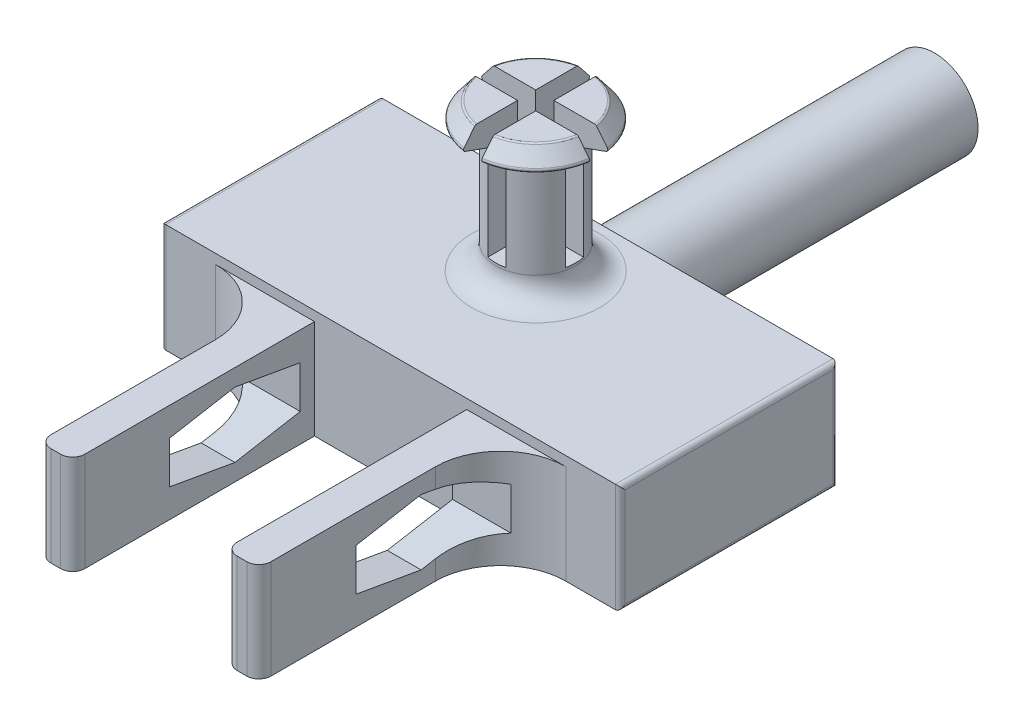
from build123d import *

# Parameters (mm, degrees)
DODANIE_WYCI_GNI_CIE1_DEPTH     = 4.5
DODANIE_WYCI_GNI_CIE2_DEPTH     = 4.1
SZKIC2_R                        = 1.8
DODANIE_WYCI_GNI_CIE3_DEPTH     = 13.5
WYTNIJ_WYCI_GNI_CIE2_DEPTH      = 23.456012558
WYTNIJ_WYCI_GNI_CIE2_DEPTH_BACK = 23.456012558
ZAOKR_GLENIE1_R                 = 0.5
ZAOKR_GLENIE2_R                 = 0.2
SZKIC4_R                        = 1.65
DODANIE_WYCI_GNI_CIE4_DEPTH     = 5.1
SZKIC5_R                        = 1.65
DODANIE_WYCI_GNI_CIE5_DEPTH     = 1
ZAOKR_GLENIE4_R                 = 1
ZAOKR_GLENIE5_R                 = 0.1
WYTNIJ_WYCI_GNI_CIE3_DEPTH      = 5


with BuildPart() as part:
    # Szkic1 → Dodanie-wyciągnięcie1 (new body)
    with BuildSketch(Plane(origin=(0, 0, 0), x_dir=(1, 0, 0), z_dir=(0, 1, 0))):
        Polygon((3.15, -4.5), (4.55, -4.5), (7.25, -4.5), (9.5, -4.5), (9.5, 4.5), (2.579268293, 4.5), (-2.579268293, 4.5), (-9.5, 4.5), (-9.5, -4.5), (-7.25, -4.5), (-4.55, -4.5), (-3.15, -4.5), align=None)
    extrude(amount=DODANIE_WYCI_GNI_CIE1_DEPTH)

    # Szkic1<7> → Dodanie-wyciągnięcie2 (add)
    with BuildSketch(Plane(origin=(0, 0, 0), x_dir=(1, 0, 0), z_dir=(0, 1, 0))):
        with BuildLine():
            Line((4.55, -14.5), (4.55, -7.2))
            ThreePointArc((4.55, -7.2), (5.340811691, -5.290811691), (7.25, -4.5))
            Line((7.25, -4.5), (3.15, -4.5))
            Line((3.15, -4.5), (3.15, -14.5))
            Line((3.15, -14.5), (4.55, -14.5))
        make_face()
        with BuildLine():
            Line((-3.15, -14.5), (-3.15, -4.5))
            Line((-3.15, -4.5), (-7.25, -4.5))
            ThreePointArc((-7.25, -4.5), (-5.340811691, -5.290811691), (-4.55, -7.2))
            Line((-4.55, -7.2), (-4.55, -14.5))
            Line((-4.55, -14.5), (-3.15, -14.5))
        make_face()
    extrude(amount=DODANIE_WYCI_GNI_CIE2_DEPTH)

    # Szkic2 → Dodanie-wyciągnięcie3 (add)
    with BuildSketch(Plane(origin=(0, 0, -4.5), x_dir=(-1, 0, 0), z_dir=(0, 0, -1))):
        with Locations((0, 2.25)):
            Circle(SZKIC2_R)
    extrude(amount=DODANIE_WYCI_GNI_CIE3_DEPTH)

    # Szkic3 → Wytnij-wyciągnięcie2 (cut, two sides: drawn at the far end of the back side and taken through both)
    with BuildSketch(Plane(origin=(-3.15, 0, 0), x_dir=(0, 0, -1), z_dir=(1, 0, 0)).offset(-WYTNIJ_WYCI_GNI_CIE2_DEPTH_BACK)):
        Polygon((-7.790001582, 3.4), (-10.490001582, 2.923917152), (-10.490001582, 1.176082848), (-7.790001582, 0.7), (-5.090001582, 1.176082848), (-5.090001582, 2.923917152), align=None)
    extrude(amount=WYTNIJ_WYCI_GNI_CIE2_DEPTH + WYTNIJ_WYCI_GNI_CIE2_DEPTH_BACK, mode=Mode.SUBTRACT)

    # Zaokrąglenie1
    zaokr_glenie1_edges = [part.edges().sort_by_distance(p)[0] for p in [
        (3.15, 2.05, 14.5),
        (4.55, 2.05, 14.5),
        (-4.55, 2.05, 14.5),
        (-3.15, 2.05, 14.5),
    ]]
    fillet(zaokr_glenie1_edges, radius=ZAOKR_GLENIE1_R)

    # Zaokrąglenie2
    zaokr_glenie2_edges = [part.edges().sort_by_distance(p)[0] for p in [
        (-9.5, 2.25, -4.5),
        (-9.5, 4.5, 0),
        (9.5, 0, 0),
        (-9.5, 2.25, 4.5),
        (9.5, 2.25, 4.5),
        (9.5, 2.25, -4.5),
        (9.5, 4.5, 0),
        (-9.5, 0, 0),
    ]]
    fillet(zaokr_glenie2_edges, radius=ZAOKR_GLENIE2_R)

    # Szkic4 → Dodanie-wyciągnięcie4 (add)
    with BuildSketch(Plane(origin=(0, 4.5, 0), x_dir=(1, 0, 0), z_dir=(0, 1, 0))):
        with Locations((0, 1.5)):
            Circle(SZKIC4_R)
    extrude(amount=DODANIE_WYCI_GNI_CIE4_DEPTH)

    # Szkic5 → Dodanie-wyciągnięcie5 (add)
    with BuildSketch(Plane(origin=(0, 9.6, 0), x_dir=(1, 0, 0), z_dir=(0, 1, 0))):
        with Locations((0, 1.5)):
            Circle(SZKIC5_R)
    extrude(amount=DODANIE_WYCI_GNI_CIE5_DEPTH)

    # Zaokrąglenie4
    zaokr_glenie4_edges = [part.edges().sort_by_distance(p)[0] for p in [
        (-1.65, 4.5, -1.5),
    ]]
    fillet(zaokr_glenie4_edges, radius=ZAOKR_GLENIE4_R)

    # Szkic7 → Obrót1 (revolve)
    with BuildSketch(Plane(origin=(0, 0, 0), x_dir=(0, 0, -1), z_dir=(1, 0, 0))):
        Polygon((3.15, 10.6), (3.65, 10.6), (4.197835565, 9.9), (3.15, 9.518619044), align=None)
    revolve(axis=Axis((0, 16.6, -1.5), (0, -1, 0)))

    # Zaokrąglenie5
    zaokr_glenie5_edges = [part.edges().sort_by_distance(p)[0] for p in [
        (0, 10.6, 0.65),
        (0, 9.9, 1.197835565),
    ]]
    fillet(zaokr_glenie5_edges, radius=ZAOKR_GLENIE5_R)

    # Szkic6 → Wytnij-wyciągnięcie3 (cut)
    with BuildSketch(Plane(origin=(0, 10.6, 0), x_dir=(1, 0, 0), z_dir=(0, 1, 0))):
        with BuildLine():
            Line((0.375, 4.664465969), (0.375, 1.875))
            Line((0.375, 1.875), (3.164465969, 1.875))
            ThreePointArc((3.164465969, 1.875), (3.186607894, 1.5), (3.164465969, 1.125))
            Line((3.164465969, 1.125), (0.375, 1.125))
            Line((0.375, 1.125), (0.375, -1.664465969))
            ThreePointArc((0.375, -1.664465969), (0, -1.686607894), (-0.375, -1.664465969))
            Line((-0.375, -1.664465969), (-0.375, 1.125))
            Line((-0.375, 1.125), (-3.164465969, 1.125))
            ThreePointArc((-3.164465969, 1.125), (-3.186607894, 1.5), (-3.164465969, 1.875))
            Line((-3.164465969, 1.875), (-0.375, 1.875))
            Line((-0.375, 1.875), (-0.375, 4.664465969))
            ThreePointArc((-0.375, 4.664465969), (0, 4.686607894), (0.375, 4.664465969))
        make_face()
    extrude(amount=-WYTNIJ_WYCI_GNI_CIE3_DEPTH, mode=Mode.SUBTRACT)


solid = part.part
